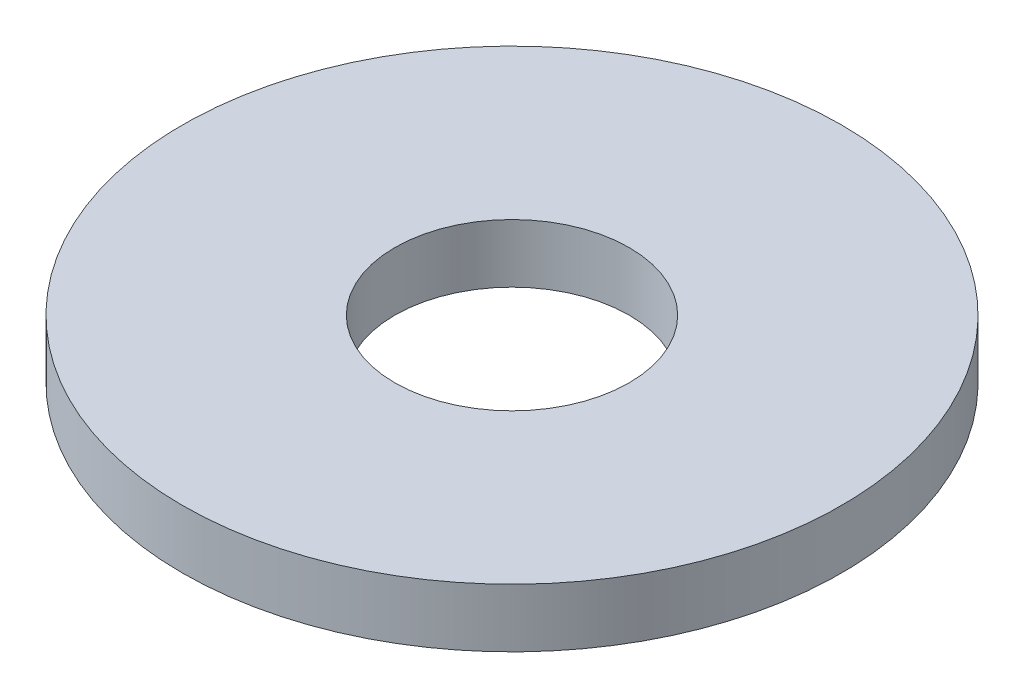
from build123d import *

# Parameters (mm, degrees)
SKETCH1_R           = 9
SKETCH1_R_2         = 3.2
BOSS_EXTRUDE1_DEPTH = 1.6


with BuildPart() as part:
    # Sketch1 → Boss-Extrude1 (new body)
    with BuildSketch(Plane(origin=(0, 0, 0), x_dir=(1, 0, 0), z_dir=(0, 1, 0))):
        Circle(SKETCH1_R)
        Circle(SKETCH1_R_2, mode=Mode.SUBTRACT)
    extrude(amount=BOSS_EXTRUDE1_DEPTH)


solid = part.part
